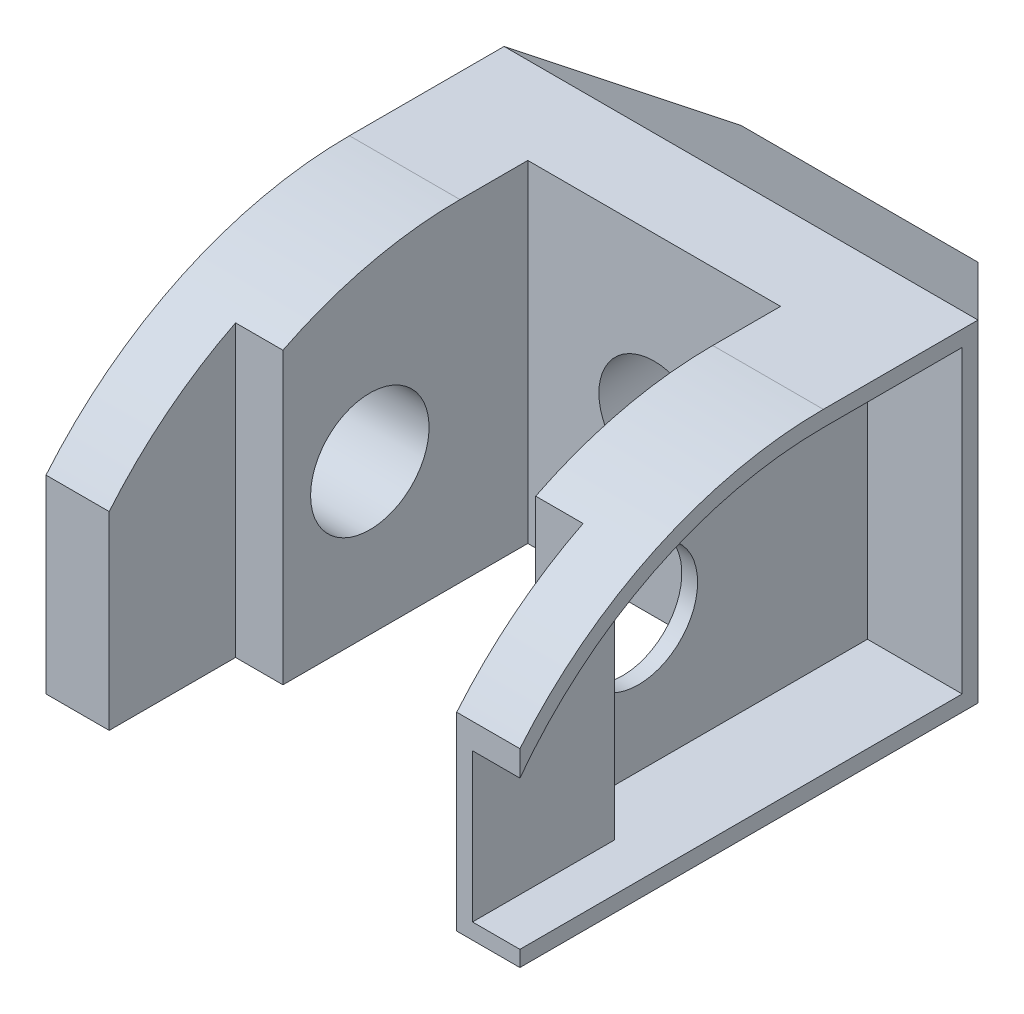
from build123d import *

# Parameters (mm, degrees)
SKETCH1_R           = 7.5
BOSS_EXTRUDE1_DEPTH = 60
CUT_EXTRUDE2_DEPTH  = 60
SKETCH3_R           = 7
CUT_EXTRUDE3_DEPTH  = 104.406963015
CHAMFER1_SIZE       = 15
SPLIT2_START        = 46
SPLIT2_OUTLINE_R    = 7.5
SPLIT2_DEPTH        = 14
SPLIT2_START_2      = 52
SPLIT2_2_DEPTH      = 8
SPLIT2_3_DEPTH      = 58
SHELL1_START        = 48
SHELL1_DEPTH        = 12
SHELL1_START_2      = 54
SHELL1_2_DEPTH      = 6
CUT_EXTRUDE4_DEPTH  = 12
CUT_EXTRUDE5_DEPTH  = 6
CUT_EXTRUDE6_DEPTH  = 6


# Read off the part's stored shape, not the designer's step: Split2, Shell1
with BuildPart() as part:
    # Sketch1 → Boss-Extrude1 (new body)
    with BuildSketch(Plane(origin=(0, 0, 0), x_dir=(0, 0, -1), z_dir=(1, 0, 0))):
        with BuildLine():
            Line((-58, 0), (-58, 24))
            ThreePointArc((-58, 24), (-40.794458011, 37.276925691), (-19.581254575, 42))
            Line((-19.581254575, 42), (0, 42))
            Line((0, 42), (15, 33.339745962))
            Line((15, 33.339745962), (15, 8.660254038))
            Line((15, 8.660254038), (0, 0))
            Line((0, 0), (-58, 0))
        make_face()
        with Locations((-31, 19)):
            Circle(SKETCH1_R, mode=Mode.SUBTRACT)
    extrude(amount=BOSS_EXTRUDE1_DEPTH)

    # Sketch2 → Cut-Extrude2 (cut)
    with BuildSketch(Plane(origin=(0, 0, 0), x_dir=(1, 0, 0), z_dir=(0, 1, 0))):
        Polygon((8, -58), (30, -58), (30, -11), (14, -11), (14, -42), (8, -42), align=None)
        Polygon((30, -11), (30, -58), (52, -58), (52, -42), (46, -42), (46, -11), align=None)
    extrude(amount=CUT_EXTRUDE2_DEPTH, mode=Mode.SUBTRACT)

    # Sketch3 → Cut-Extrude3 (cut, through all)
    with BuildSketch(Plane(origin=(0, 0, -15), x_dir=(-1, 0, 0), z_dir=(0, 0, -1))):
        with Locations(Location((-30, 21, 0), (0, 0, 90))):
            Circle(SKETCH3_R)
    extrude(amount=-CUT_EXTRUDE3_DEPTH, mode=Mode.SUBTRACT)

    # Chamfer1
    chamfer1_edges = [part.edges().sort_by_distance(p)[0] for p in [
        (0, 21, -15),
        (60, 21, -15),
    ]]
    chamfer(chamfer1_edges, length=CHAMFER1_SIZE)

    # Split2 3 outline → Split2 3 (cut)
    with BuildSketch(Plane.XY):
        Polygon((60, 42), (46, 42), (46, 0), (52, 0), (60, 0), align=None)
    extrude(amount=SPLIT2_3_DEPTH, mode=Mode.SUBTRACT)


with BuildPart() as body_2:
    # Split2 outline → Split2 (new body)
    with BuildSketch(Plane.YZ.offset(SPLIT2_START)):
        with BuildLine():
            Line((0, 42), (0, 0))
            Line((0, 0), (42, 0))
            Line((42, 0), (42, 19.581254575))
            ThreePointArc((42, 19.581254575), (40.654979081, 31.100499804), (36.692279575, 42))
            Line((36.692279575, 42), (0, 42))
        make_face()
        with Locations((19, 31)):
            Circle(SPLIT2_OUTLINE_R, mode=Mode.SUBTRACT)
    extrude(amount=SPLIT2_DEPTH)

    # Split2 2 outline → Split2 2 (add)
    with BuildSketch(Plane.YZ.offset(SPLIT2_START_2)):
        with BuildLine():
            Line((0, 58), (0, 42))
            Line((0, 42), (36.692279575, 42))
            ThreePointArc((36.692279575, 42), (31.171755598, 50.654934168), (24, 58))
            Line((24, 58), (0, 58))
        make_face()
    extrude(amount=SPLIT2_2_DEPTH)

    # Shell1 outline → Shell1 (cut)
    with BuildSketch(Plane.YZ.offset(SHELL1_START)):
        with BuildLine():
            ThreePointArc((40, 19.581254575), (38.846252688, 30.042067598), (35.440474621, 40))
            Line((35.440474621, 40), (22.041381265, 40))
            ThreePointArc((22.041381265, 40), (19, 21.5), (15.958618735, 40))
            Line((15.958618735, 40), (2, 40))
            Line((2, 40), (2, 2))
            Line((2, 2), (40, 2))
            Line((40, 2), (40, 19.581254575))
        make_face()
    extrude(amount=SHELL1_DEPTH, mode=Mode.SUBTRACT)

    # Shell1 2 outline → Shell1 2 (cut)
    with BuildSketch(Plane.YZ.offset(SHELL1_START_2)):
        with BuildLine():
            Line((22.041381265, 40), (35.440474621, 40))
            ThreePointArc((35.440474621, 40), (30.201195976, 48.644437917), (23.267794641, 56))
            Line((23.267794641, 56), (2, 56))
            Line((2, 56), (2, 40))
            Line((2, 40), (15.958618735, 40))
            ThreePointArc((15.958618735, 40), (19, 40.5), (22.041381265, 40))
        make_face()
    extrude(amount=SHELL1_2_DEPTH, mode=Mode.SUBTRACT)

    # Sketch4 → Cut-Extrude4 (cut)
    with BuildSketch(Plane(origin=(48, 0, 0), x_dir=(0, 0, -1), z_dir=(1, 0, 0))):
        with BuildLine():
            Line((-40, 15.958618735), (-40, 22.041381265))
            ThreePointArc((-40, 22.041381265), (-21.5, 19), (-40, 15.958618735))
        make_face()
    extrude(amount=CUT_EXTRUDE4_DEPTH, mode=Mode.SUBTRACT)

    # Sketch5 → Cut-Extrude5 (cut)
    with BuildSketch(Plane(origin=(54, 0, 0), x_dir=(0, 0, -1), z_dir=(1, 0, 0))):
        Polygon((-40, 14.184038534), (-40, 24.39394248), (-43.350764403, 21.043178076), align=None)
    extrude(amount=CUT_EXTRUDE5_DEPTH, mode=Mode.SUBTRACT)

    # Sketch6 → Cut-Extrude6 (cut)
    with BuildSketch(Plane(origin=(60, 0, 0), x_dir=(0, 0, -1), z_dir=(1, 0, 0))):
        with BuildLine():
            ThreePointArc((-56, 23.267794641), (-57.020752822, 22.038042064), (-58, 20.77498914))
            Line((-58, 20.77498914), (-58, 2))
            Line((-58, 2), (-56, 2))
            Line((-56, 2), (-56, 23.267794641))
        make_face()
    extrude(amount=-CUT_EXTRUDE6_DEPTH, mode=Mode.SUBTRACT)


with BuildPart() as part_1:
    add(part.part)

    # Combine1: union body 2
    add(body_2.part)


solid = part_1.part
